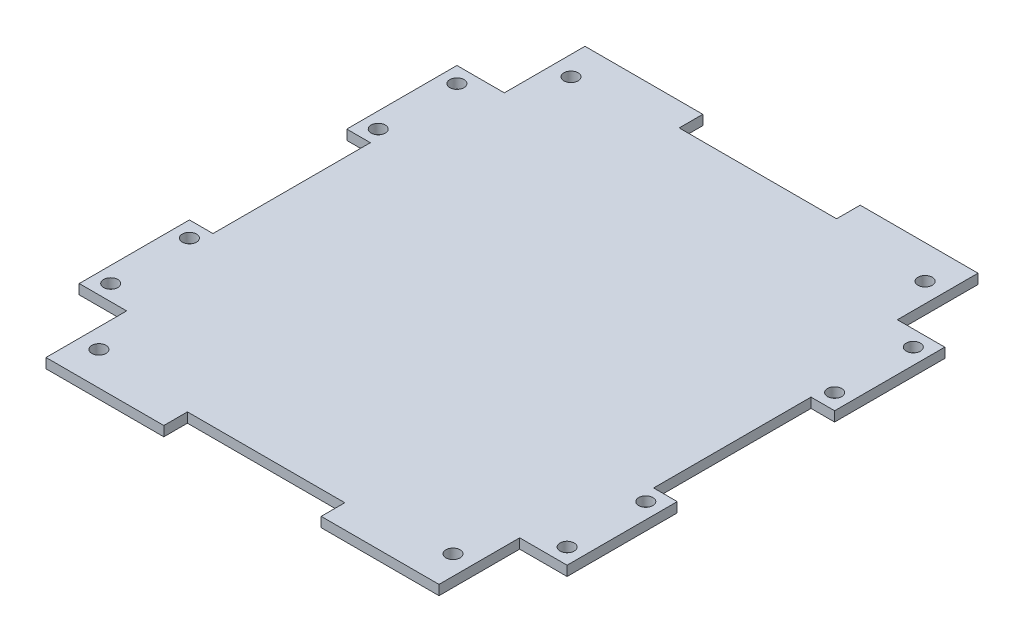
from build123d import *

# Parameters (mm, degrees)
SKETCH1_R           = 2.286
BOSS_EXTRUDE1_DEPTH = 3.175
SKETCH2_R           = 2.286
CUT_EXTRUDE1_DEPTH  = 118.380570155


with BuildPart() as part:
    # Sketch1 → Boss-Extrude1 (new body)
    with BuildSketch(Plane(origin=(0, 0, 0), x_dir=(1, 0, 0), z_dir=(0, 1, 0))):
        Polygon((-25.4, 86.995), (-63.43142, 86.995), (-63.43142, 60.96), (-78.74, 60.96), (-78.74, 25.4), (-71.12, 25.4), (-71.12, -25.4), (-78.74, -25.4), (-78.74, -60.96), (-63.43142, -60.96), (-63.43142, -86.995), (-25.4, -86.995), (-25.4, -79.375), (25.4, -79.375), (25.4, -86.995), (63.43142, -86.995), (63.43142, -60.96), (78.74, -60.96), (78.74, -25.4), (71.12, -25.4), (71.12, 25.4), (78.74, 25.4), (78.74, 60.96), (63.43142, 60.96), (63.43142, 86.995), (25.4, 86.995), (25.4, 79.375), (-25.4, 79.375), align=None)
        with Locations((-57.15, 76.2)):
            Circle(SKETCH1_R, mode=Mode.SUBTRACT)
        with Locations((57.15, 76.2)):
            Circle(SKETCH1_R, mode=Mode.SUBTRACT)
        with Locations((57.15, -76.2)):
            Circle(SKETCH1_R, mode=Mode.SUBTRACT)
        with Locations((-57.15, -76.2)):
            Circle(SKETCH1_R, mode=Mode.SUBTRACT)
    extrude(amount=BOSS_EXTRUDE1_DEPTH)

    # Sketch2 → Cut-Extrude1 (cut, through all)
    with BuildSketch(Plane(origin=(0, 3.175, 0), x_dir=(1, 0, 0), z_dir=(0, 1, 0))):
        with Locations((-73.66, -30.48)):
            Circle(SKETCH2_R)
        with Locations((-73.66, -55.88)):
            Circle(SKETCH2_R)
        with Locations((73.66, -55.88)):
            Circle(SKETCH2_R)
        with Locations((73.66, -30.48)):
            Circle(SKETCH2_R)
        with Locations((73.66, 30.48)):
            Circle(SKETCH2_R)
        with Locations((73.66, 55.88)):
            Circle(SKETCH2_R)
        with Locations((-73.66, 55.88)):
            Circle(SKETCH2_R)
        with Locations((-73.66, 30.48)):
            Circle(SKETCH2_R)
    extrude(amount=-CUT_EXTRUDE1_DEPTH, mode=Mode.SUBTRACT)


solid = part.part
